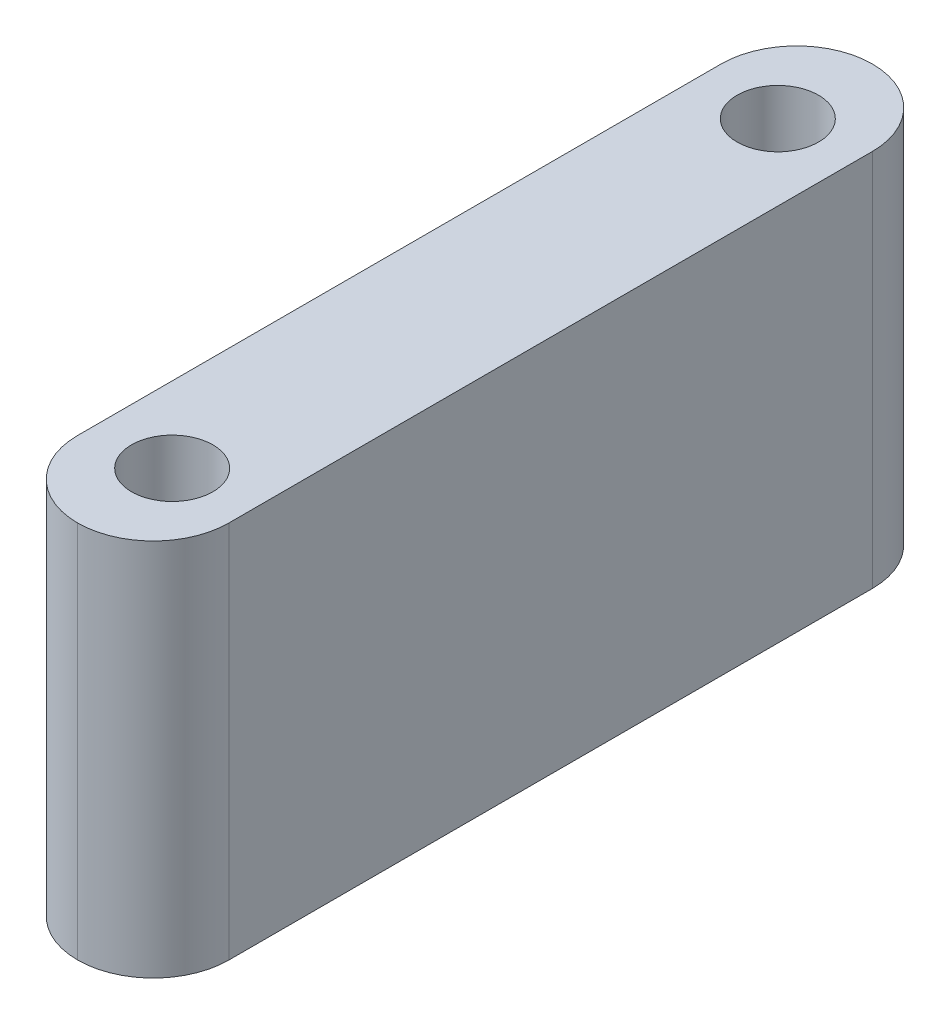
from build123d import *

# Parameters (mm, degrees)
SKETCH1_W           = 8
SKETCH1_H           = 42
SKETCH1_R           = 2.15
BOSS_EXTRUDE1_DEPTH = 20
FILLET1_R           = 4


with BuildPart() as part:
    # Sketch1 → Boss-Extrude1 (new body)
    with BuildSketch(Plane(origin=(0, 0, 0), x_dir=(1, 0, 0), z_dir=(0, 1, 0))):
        with Locations((-4, 21)):
            Rectangle(SKETCH1_W, SKETCH1_H)
        with Locations(Location((-4, 37, 0), (0, 0, 270))):
            Circle(SKETCH1_R, mode=Mode.SUBTRACT)
        with Locations(Location((-4, 5, 0), (0, 0, 90))):
            Circle(SKETCH1_R, mode=Mode.SUBTRACT)
    extrude(amount=BOSS_EXTRUDE1_DEPTH)

    # Fillet1
    fillet1_edges = [part.edges().sort_by_distance(p)[0] for p in [
        (0, 10, 0),
        (-8, 10, -42),
        (0, 10, -42),
        (-8, 10, 0),
    ]]
    fillet(fillet1_edges, radius=FILLET1_R - 0.0001)  # a hair under: the kernel refuses the full size


solid = part.part
